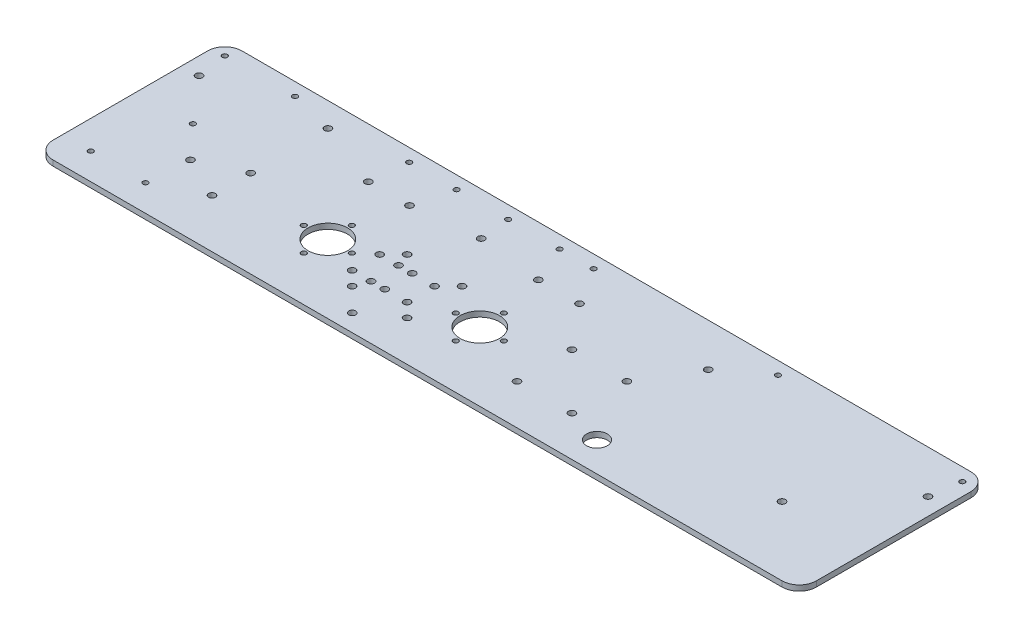
from build123d import *

# Parameters (mm, degrees)
SKETCH1_R           = 2
SKETCH1_R_2         = 1.5
SKETCH1_R_3         = 6
SKETCH1_R_4         = 11.5
BOSS_EXTRUDE1_DEPTH = 3.175
FILLET1_R           = 10
SKETCH2_R           = 2
CUT_EXTRUDE1_DEPTH  = 10
SKETCH3_R           = 2
CUT_EXTRUDE2_DEPTH  = 10
SKETCH4_R           = 1.5
SKETCH4_R_2         = 2
CUT_EXTRUDE3_DEPTH  = 6.35


with BuildPart() as part:
    # Sketch1 → Boss-Extrude1 (new body)
    with BuildSketch(Plane(origin=(0, 0, 0), x_dir=(1, 0, 0), z_dir=(0, 1, 0))):
        Polygon((-26.799577535, 0), (417.700422465, 0), (417.700422465, 17.22815868), (417.700422465, 110), (-26.799577535, 110), align=None)
        with Locations((23.200422465, 40)):
            Circle(SKETCH1_R, mode=Mode.SUBTRACT)
        with Locations((89.200422465, 40)):
            Circle(SKETCH1_R_2, mode=Mode.SUBTRACT)
        with Locations((103.200422465, 26)):
            Circle(SKETCH1_R_2, mode=Mode.SUBTRACT)
        with Locations((117.200422465, 40)):
            Circle(SKETCH1_R_2, mode=Mode.SUBTRACT)
        with Locations((177.700422465, 40)):
            Circle(SKETCH1_R_2, mode=Mode.SUBTRACT)
        with Locations((191.700422465, 26)):
            Circle(SKETCH1_R_2, mode=Mode.SUBTRACT)
        with Locations((205.700422465, 40)):
            Circle(SKETCH1_R_2, mode=Mode.SUBTRACT)
        with Locations((367.700422465, 40)):
            Circle(SKETCH1_R, mode=Mode.SUBTRACT)
        with Locations((147.450422465, 10)):
            Circle(SKETCH1_R, mode=Mode.SUBTRACT)
        with Locations((282.700422465, 17.22815868)):
            Circle(SKETCH1_R_3, mode=Mode.SUBTRACT)
        with Locations((-16.799577535, 85)):
            Circle(SKETCH1_R, mode=Mode.SUBTRACT)
        with Locations((147.450422465, 85)):
            Circle(SKETCH1_R, mode=Mode.SUBTRACT)
        with Locations((103.200422465, 54)):
            Circle(SKETCH1_R_2, mode=Mode.SUBTRACT)
        with Locations((103.200422465, 40)):
            Circle(SKETCH1_R_4, mode=Mode.SUBTRACT)
        with Locations((279.700422465, 85)):
            Circle(SKETCH1_R, mode=Mode.SUBTRACT)
        with Locations((191.700422465, 54)):
            Circle(SKETCH1_R_2, mode=Mode.SUBTRACT)
        with Locations((191.700422465, 40)):
            Circle(SKETCH1_R_4, mode=Mode.SUBTRACT)
        with Locations((407.700422465, 85)):
            Circle(SKETCH1_R, mode=Mode.SUBTRACT)
        with Locations((-19.299577535, 102.5)):
            Circle(SKETCH1_R_2, mode=Mode.SUBTRACT)
        with Locations((88.075422465, 102.5)):
            Circle(SKETCH1_R_2, mode=Mode.SUBTRACT)
        with Locations((195.450422465, 102.5)):
            Circle(SKETCH1_R_2, mode=Mode.SUBTRACT)
        with Locations((302.825422465, 102.5)):
            Circle(SKETCH1_R_2, mode=Mode.SUBTRACT)
        with Locations((410.200422465, 102.5)):
            Circle(SKETCH1_R_2, mode=Mode.SUBTRACT)
    extrude(amount=BOSS_EXTRUDE1_DEPTH)

    # Fillet1
    fillet1_edges = [part.edges().sort_by_distance(p)[0] for p in [
        (417.700422465, 1.5875, -110),
        (417.700422465, 1.5875, 0),
        (-26.799577535, 1.5875, 0),
        (-26.799577535, 1.5875, -110),
    ]]
    fillet(fillet1_edges, radius=FILLET1_R)

    # Sketch2 → Cut-Extrude1 (cut)
    with BuildSketch(Plane(origin=(0, 3.175, 0), x_dir=(1, 0, 0), z_dir=(0, 1, 0))):
        with Locations((133.950422465, 55.40559892)):
            Circle(SKETCH2_R)
        with Locations((165.950422465, 55.40559892)):
            Circle(SKETCH2_R)
        with Locations((133.950422465, 23.40559892)):
            Circle(SKETCH2_R)
        with Locations((165.950422465, 23.40559892)):
            Circle(SKETCH2_R)
        with Locations((157.950422465, 31.40559892)):
            Circle(SKETCH2_R)
        with Locations((125.950422465, 31.40559892)):
            Circle(SKETCH2_R)
        with Locations((125.950422465, 47.40559892)):
            Circle(SKETCH2_R)
        with Locations((157.950422465, 47.40559892)):
            Circle(SKETCH2_R)
    extrude(amount=-CUT_EXTRUDE1_DEPTH, mode=Mode.SUBTRACT)

    # Sketch3 → Cut-Extrude2 (cut)
    with BuildSketch(Plane.XZ):
        with Locations((136.950422465, -47.40559892)):
            Circle(SKETCH3_R)
        with Locations((144.950422465, -31.40559892)):
            Circle(SKETCH3_R)
        with Locations((136.950422465, -31.40559892)):
            Circle(SKETCH3_R)
        with Locations((144.950422465, -47.40559892)):
            Circle(SKETCH3_R)
        with Locations((229.950422465, -55.40559892)):
            Circle(SKETCH3_R)
        with Locations((229.950422465, -23.40559892)):
            Circle(SKETCH3_R)
        with Locations((261.950422465, -23.40559892)):
            Circle(SKETCH3_R)
        with Locations((261.950422465, -55.40559892)):
            Circle(SKETCH3_R)
    extrude(amount=-CUT_EXTRUDE2_DEPTH, mode=Mode.SUBTRACT)

    # Sketch4 → Cut-Extrude3 (cut)
    with BuildSketch(Plane(origin=(0, 3.175, 0), x_dir=(1, 0, 0), z_dir=(0, 1, 0))):
        with Locations((21.590660574, 102.5)):
            Circle(SKETCH4_R)
        with Locations((5.664827234, 58.95279946)):
            Circle(SKETCH4_R)
        with Locations((-10.261006106, 15.40559892)):
            Circle(SKETCH4_R)
        with Locations((47.350422465, 50.90559892)):
            Circle(SKETCH4_R_2)
        with Locations((115.670834955, 102.5)):
            Circle(SKETCH4_R)
        with Locations((145.670834955, 102.5)):
            Circle(SKETCH4_R)
        with Locations((175.670834955, 102.5)):
            Circle(SKETCH4_R)
        with Locations((47.350422465, 95.90559892)):
            Circle(SKETCH4_R_2)
        with Locations((21.590660574, 15.40559892)):
            Circle(SKETCH4_R)
        with Locations((47.350422465, 28.40559892)):
            Circle(SKETCH4_R_2)
        with Locations((208.950422465, 80.80559892)):
            Circle(SKETCH4_R_2)
        with Locations((184.950422465, 80.80559892)):
            Circle(SKETCH4_R_2)
        with Locations((109.950422465, 80.80559892)):
            Circle(SKETCH4_R_2)
        with Locations((85.950422465, 80.80559892)):
            Circle(SKETCH4_R_2)
    extrude(amount=-CUT_EXTRUDE3_DEPTH, mode=Mode.SUBTRACT)


solid = part.part
